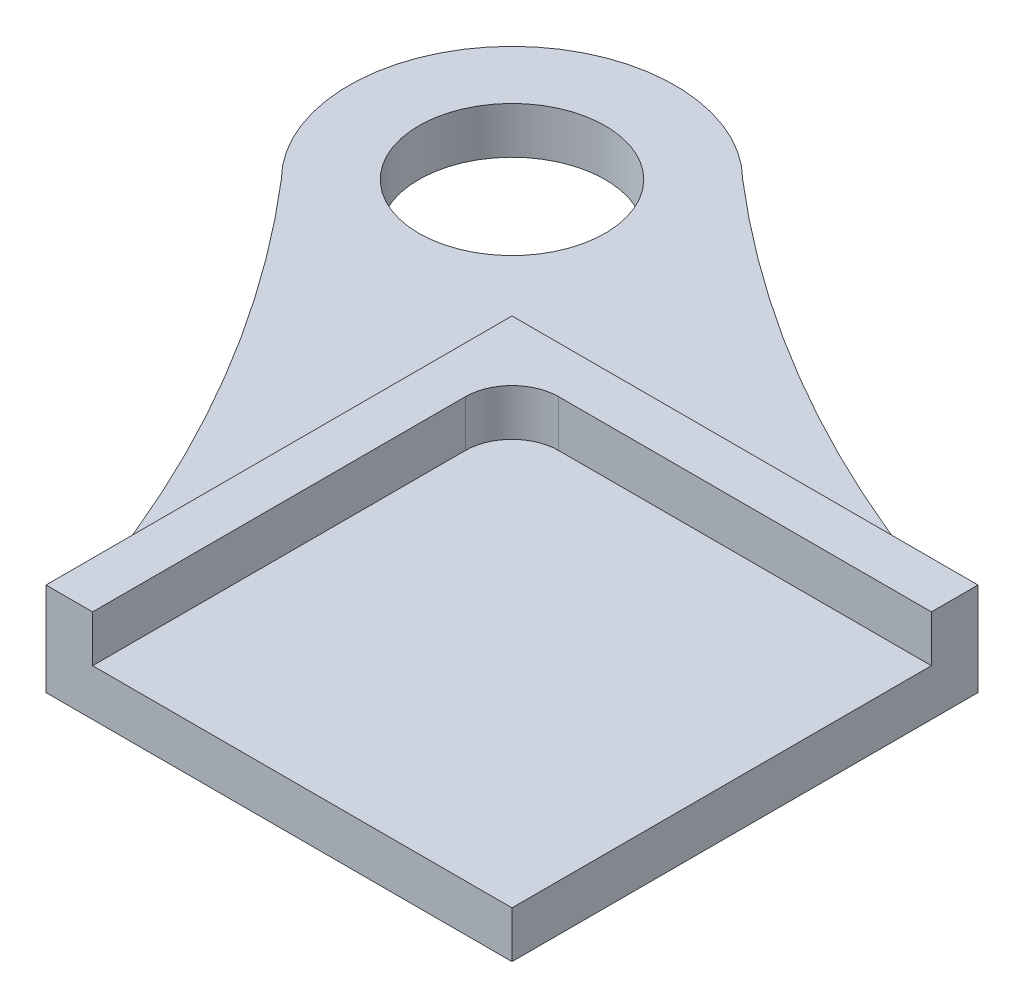
from build123d import *

# Parameters (mm, degrees)
SKETCH1_R           = 4
BOSS_EXTRUDE2_DEPTH = 2
BOSS_EXTRUDE3_DEPTH = 2


with BuildPart() as part:
    # Sketch1 → Boss-Extrude2 (new body)
    with BuildSketch(Plane(origin=(0, 0, 0), x_dir=(1, 0, 0), z_dir=(0, 1, 0))):
        with BuildLine():
            Line((10, -10), (10, 10))
            ThreePointArc((10, 10), (-1.698109598, 14.836970648), (-12.121067812, 22.020562736))
            ThreePointArc((-12.121067812, 22.020562736), (-22.020562736, 22.021067812), (-22.021067812, 12.121572888))
            ThreePointArc((-22.021067812, 12.121572888), (-14.837163749, 1.698406667), (-10, -10))
            Line((-10, -10), (10, -10))
        make_face()
        with Locations((-17.071067812, 17.071067812)):
            Circle(SKETCH1_R, mode=Mode.SUBTRACT)
    extrude(amount=-BOSS_EXTRUDE2_DEPTH)

    # Sketch2 → Boss-Extrude3 (add)
    with BuildSketch(Plane(origin=(0, 0, 0), x_dir=(1, 0, 0), z_dir=(0, 1, 0))):
        with BuildLine():
            Line((10, 8), (10, 10))
            Line((10, 10), (-10, 10))
            Line((-10, 10), (-10, -10))
            Line((-10, -10), (-8, -10))
            Line((-8, -10), (-8, 6))
            ThreePointArc((-8, 6), (-7.414213562, 7.414213562), (-6, 8))
            Line((-6, 8), (10, 8))
        make_face()
    extrude(amount=BOSS_EXTRUDE3_DEPTH)


solid = part.part
